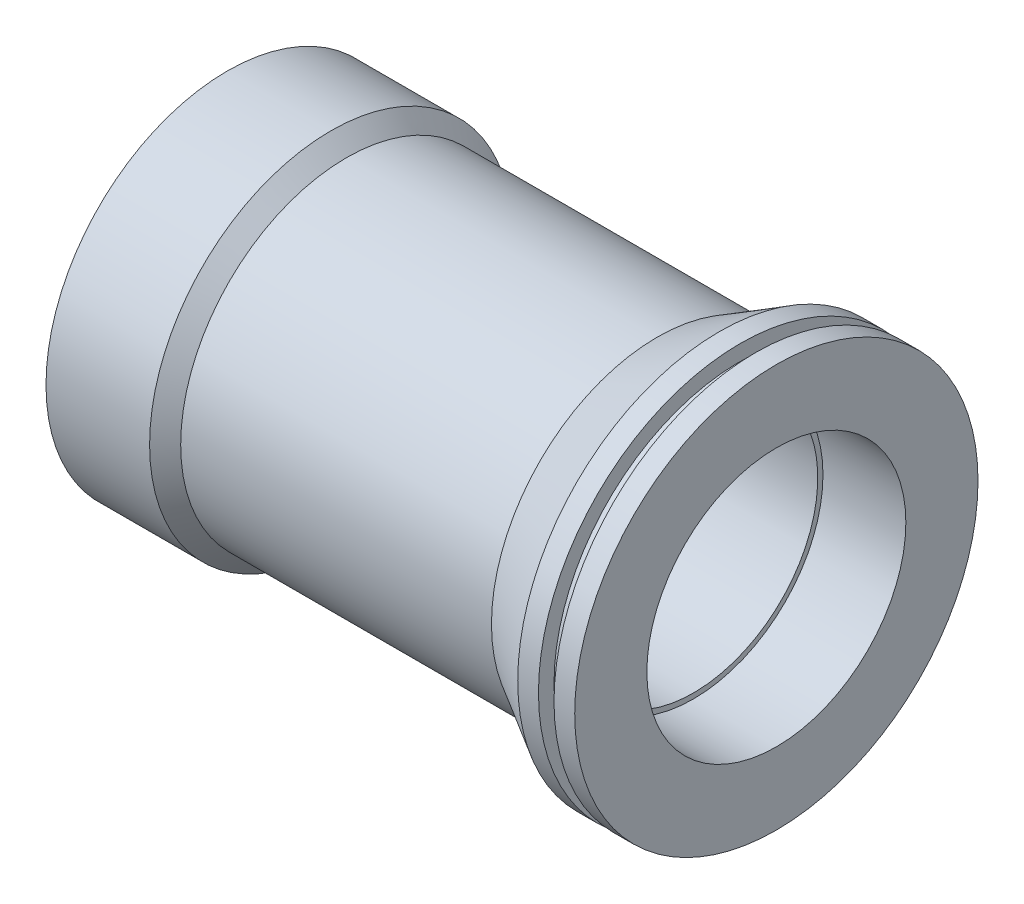
from build123d import *


with BuildPart() as part:
    # Esquisse2 → Révolution1 (revolve)
    with BuildSketch(Plane.XY):
        Polygon((88.40653975, 38.92820323), (84.40653975, 38.92820323), (84.40653975, 35.92820323), (81.40653975, 35.92820323), (81.40653975, 38.92820323), (77.40653975, 38.92820323), (65.40653975, 32), (5.40653975, 32), (2.40653975, 35), (-17.59346025, 35), (-17.59346025, 30), (-2.59346025, 30), (-2.59346025, 22), (7.40653975, 22), (7.40653975, 23), (27.40653975, 23), (27.40653975, 24), (72.40653975, 24), (72.40653975, 25), (88.40653975, 25), align=None)
    revolve(axis=Axis((-89.207905873, 0, 0), (1, 0, 0)))


solid = part.part
